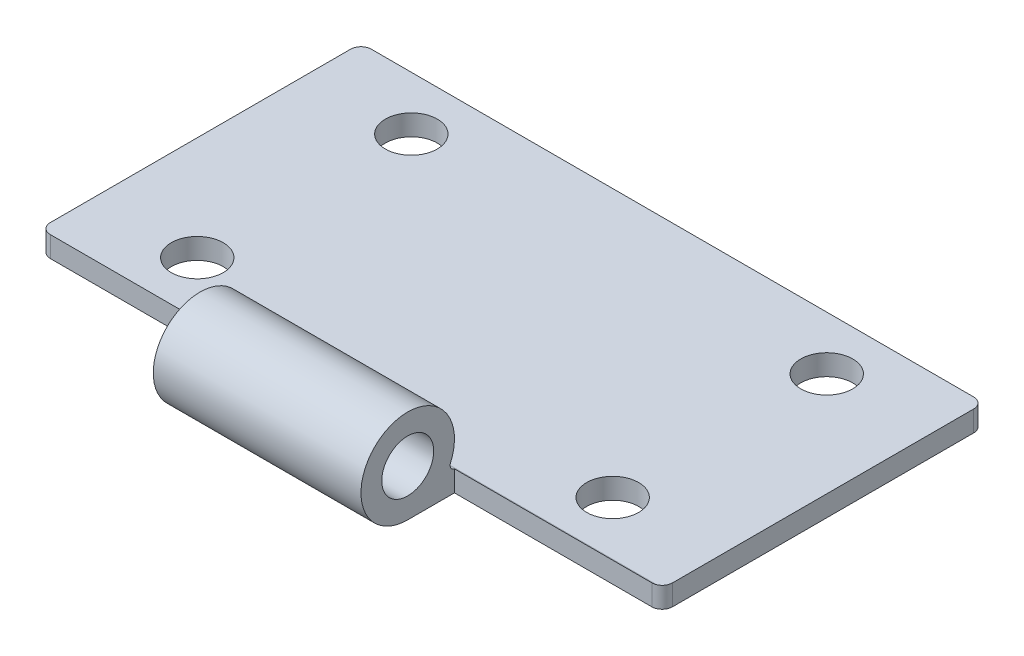
from build123d import *

# Parameters (mm, degrees)
SKETCH1_R           = 2.5
BOSS_EXTRUDE1_DEPTH = 60
SKETCH2_W           = 20
SKETCH2_H           = 9.082575695
SKETCH2_H_2         = 9
CUT_EXTRUDE1_DEPTH  = 60
SKETCH3_R           = 2.5
CUT_EXTRUDE2_DEPTH  = 60
FILLET1_R           = 1


with BuildPart() as part:
    # Sketch1 → Boss-Extrude1 (new body)
    with BuildSketch(Plane(origin=(0, 0, 0), x_dir=(0, 0, -1), z_dir=(1, 0, 0))):
        with BuildLine():
            Line((248.805037947, 0), (213.305037947, 0))
            ThreePointArc((213.305037947, 0), (210.840286438, 8.264970119), (217.429356072, 2.7))
            ThreePointArc((217.429356072, 2.7), (217.469283629, 2.226138721), (217.887613642, 2))
            Line((217.887613642, 2), (248.805037947, 2))
            Line((248.805037947, 2), (248.805037947, 0))
        make_face()
        with Locations((213.305037947, 4.5)):
            Circle(SKETCH1_R, mode=Mode.SUBTRACT)
    extrude(amount=BOSS_EXTRUDE1_DEPTH)

    # Sketch2 → Cut-Extrude1 (cut)
    with BuildSketch(Plane(origin=(0, 0, 0), x_dir=(1, 0, 0), z_dir=(0, 1, 0))):
        with Locations((10, 213.346325795)):
            Rectangle(SKETCH2_W, SKETCH2_H)
        with Locations((50, 213.305037947)):
            Rectangle(SKETCH2_W, SKETCH2_H_2)
    extrude(amount=CUT_EXTRUDE1_DEPTH, mode=Mode.SUBTRACT)

    # Sketch3 → Cut-Extrude2 (cut)
    with BuildSketch(Plane(origin=(0, 2, 0), x_dir=(1, 0, 0), z_dir=(0, 1, 0))):
        with Locations((10, 243.652133896)):
            Circle(SKETCH3_R)
        with Locations((10, 223.040517693)):
            Circle(SKETCH3_R)
        with Locations((50, 223.040517693)):
            Circle(SKETCH3_R)
        with Locations((50, 243.652133896)):
            Circle(SKETCH3_R)
    extrude(amount=-CUT_EXTRUDE2_DEPTH, mode=Mode.SUBTRACT)

    # Fillet1
    fillet1_edges = [part.edges().sort_by_distance(p)[0] for p in [
        (0, 1, -217.887613642),
        (0, 1, -248.805037947),
        (60, 1, -248.805037947),
        (60, 1.003432943, -217.805037947),
    ]]
    fillet(fillet1_edges, radius=FILLET1_R)


solid = part.part
